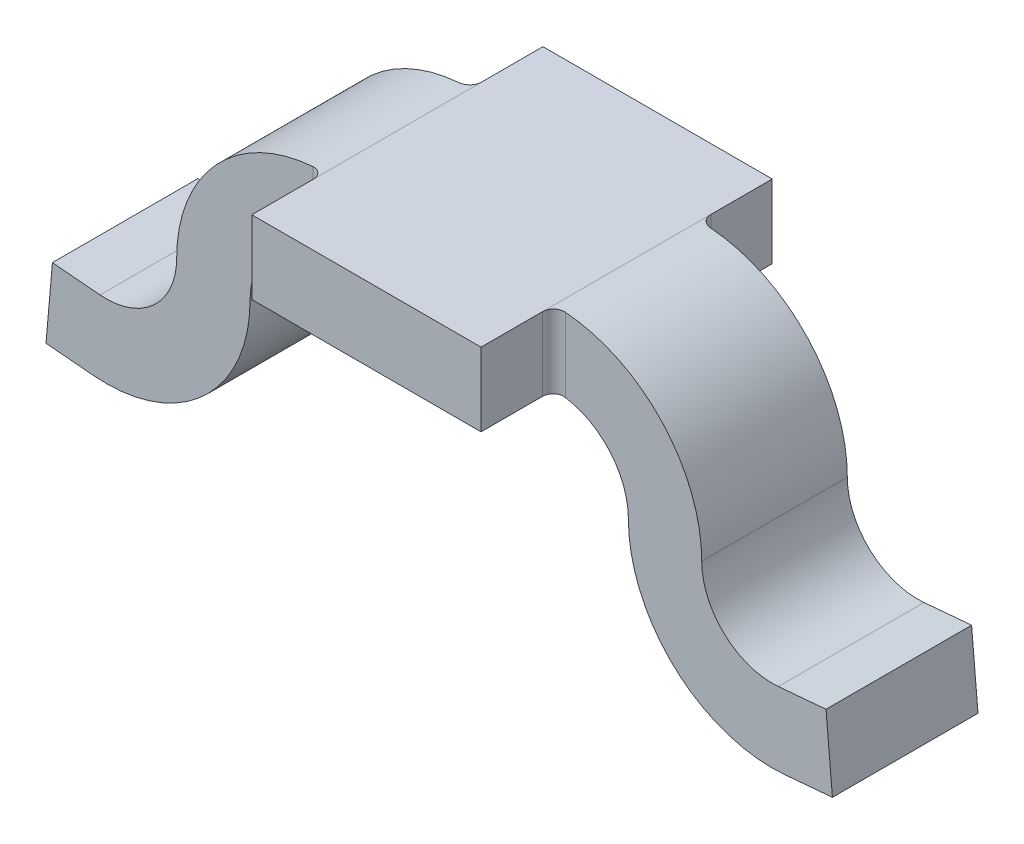
from build123d import *

# Parameters (mm, degrees)
BOSS_EXTRUDE1_DEPTH     = 1.5
CUT_EXTRUDE1_DEPTH      = 5.200365106
CUT_EXTRUDE1_DEPTH_BACK = 5.200365106
SKETCH2_OUTSIDE_W       = 10.442
SKETCH2_OUTSIDE_H       = 6.582
FILLET1_R               = 0.1


with BuildPart() as part:
    # Sketch1 → Boss-Extrude1 (new, symmetric)
    with BuildSketch(Plane.XY):
        with BuildLine():
            Line((1, 0), (-1, 0))
            ThreePointArc((-1, 0), (-1.459619408, -0.190380592), (-1.65, -0.65))
            ThreePointArc((-1.65, -0.65), (-2.057061231, -1.575117021), (-3.014135626, -1.9))
            Line((-3.014135626, -1.9), (-3.43, -1.863616582))
            Line((-3.43, -1.863616582), (-3.374220325, -1.226051975))
            Line((-3.374220325, -1.226051975), (-2.958355951, -1.262435393))
            ThreePointArc((-2.958355951, -1.262435393), (-2.489438964, -1.103259525), (-2.29, -0.65))
            ThreePointArc((-2.29, -0.65), (-1.912167748, 0.262167748), (-1, 0.64))
            Line((-1, 0.64), (1, 0.64))
            ThreePointArc((1, 0.64), (1.912167748, 0.262167748), (2.29, -0.65))
            ThreePointArc((2.29, -0.65), (2.489438964, -1.103259525), (2.958355951, -1.262435393))
            Line((2.958355951, -1.262435393), (3.374220325, -1.226051975))
            Line((3.374220325, -1.226051975), (3.43, -1.863616582))
            Line((3.43, -1.863616582), (3.014135626, -1.9))
            ThreePointArc((3.014135626, -1.9), (2.057061231, -1.575117021), (1.65, -0.65))
            ThreePointArc((1.65, -0.65), (1.459619408, -0.190380592), (1, 0))
        make_face()
    extrude(amount=BOSS_EXTRUDE1_DEPTH, both=True)

    # Sketch2 outside → Cut-Extrude1 (cut, two sides: drawn at the far end of the back side and taken through both)
    with BuildSketch(Plane(origin=(0, 0, 0), x_dir=(1, 0, 0), z_dir=(0, 1, 0)).offset(-CUT_EXTRUDE1_DEPTH_BACK)):
        Rectangle(SKETCH2_OUTSIDE_W, SKETCH2_OUTSIDE_H)
        Polygon((-1, 1.27), (1, 1.27), (1, 0.635), (3.43, 0.635), (3.43, -0.635), (1, -0.635), (1, -1.27), (-1, -1.27), (-1, -0.635), (-3.43, -0.635), (-3.43, 0.635), (-1, 0.635), align=None, mode=Mode.SUBTRACT)
    extrude(amount=CUT_EXTRUDE1_DEPTH + CUT_EXTRUDE1_DEPTH_BACK, mode=Mode.SUBTRACT)

    # Fillet1
    # the kernel refuses this fillet: 0.1 mm, written as the material it adds along each edge
    with BuildSketch(Plane(origin=(1, -0.25, 0.635), x_dir=(1, 0, 0), z_dir=(0, 1, 0))) as fillet1_piece_1_section:
        with BuildLine():
            CenterArc((FILLET1_R, -FILLET1_R), FILLET1_R, 90, 90)
            Line((0, -FILLET1_R), (0, 0))
            Line((0, 0), (FILLET1_R, 0))
        make_face()
    fillet1_piece_1 = extrude(amount=1.14, mode=Mode.PRIVATE)
    fillet1_piece_1 = fillet1_piece_1 - Plane(origin=(1, -0.65, 0.643680782), x_dir=(1, 0, 0), z_dir=(0, 0, 1)) * Cylinder(0.65, 3, mode=Mode.PRIVATE)
    fillet1_piece_1 = fillet1_piece_1 & Plane(origin=(1, -0.65, 0.643680782), x_dir=(0, 1, 0), z_dir=(0, 0, 1)) * Cylinder(1.29, 3, mode=Mode.PRIVATE)
    add(fillet1_piece_1)
    with BuildSketch(Plane(origin=(1, -0.25, -0.635), x_dir=(1, 0, 0), z_dir=(0, 1, 0))) as fillet1_piece_2_section:
        with BuildLine():
            CenterArc((FILLET1_R, FILLET1_R), FILLET1_R, 180, 90)
            Line((0, FILLET1_R), (0, 0))
            Line((0, 0), (FILLET1_R, 0))
        make_face()
    fillet1_piece_2 = extrude(amount=1.14, mode=Mode.PRIVATE)
    fillet1_piece_2 = fillet1_piece_2 - Plane(origin=(1, -0.65, -0.643680782), x_dir=(1, 0, 0), z_dir=(0, 0, 1)) * Cylinder(0.65, 3, mode=Mode.PRIVATE)
    fillet1_piece_2 = fillet1_piece_2 & Plane(origin=(1, -0.65, -0.643680782), x_dir=(0, 1, 0), z_dir=(0, 0, 1)) * Cylinder(1.29, 3, mode=Mode.PRIVATE)
    add(fillet1_piece_2)
    with BuildSketch(Plane(origin=(-1, -0.25, 0.635), x_dir=(0, 0, 1), z_dir=(0, 1, 0))) as fillet1_piece_3_section:
        with BuildLine():
            CenterArc((FILLET1_R, -FILLET1_R), FILLET1_R, 90, 90)
            Line((0, -FILLET1_R), (0, 0))
            Line((0, 0), (FILLET1_R, 0))
        make_face()
    fillet1_piece_3 = extrude(amount=1.14, mode=Mode.PRIVATE)
    fillet1_piece_3 = fillet1_piece_3 - Plane(origin=(-1, -0.65, 0.643680782), x_dir=(0, 1, 0), z_dir=(0, 0, 1)) * Cylinder(0.65, 3, mode=Mode.PRIVATE)
    fillet1_piece_3 = fillet1_piece_3 & Plane(origin=(-1, -0.65, 0.643680782), x_dir=(-1, 0, 0), z_dir=(0, 0, 1)) * Cylinder(1.29, 3, mode=Mode.PRIVATE)
    add(fillet1_piece_3)
    with BuildSketch(Plane(origin=(-1, -0.25, -0.635), x_dir=(0, 0, -1), z_dir=(0, 1, 0))) as fillet1_piece_4_section:
        with BuildLine():
            CenterArc((FILLET1_R, FILLET1_R), FILLET1_R, 180, 90)
            Line((0, FILLET1_R), (0, 0))
            Line((0, 0), (FILLET1_R, 0))
        make_face()
    fillet1_piece_4 = extrude(amount=1.14, mode=Mode.PRIVATE)
    fillet1_piece_4 = fillet1_piece_4 - Plane(origin=(-1, -0.65, -0.643680782), x_dir=(0, 1, 0), z_dir=(0, 0, 1)) * Cylinder(0.65, 3, mode=Mode.PRIVATE)
    fillet1_piece_4 = fillet1_piece_4 & Plane(origin=(-1, -0.65, -0.643680782), x_dir=(-1, 0, 0), z_dir=(0, 0, 1)) * Cylinder(1.29, 3, mode=Mode.PRIVATE)
    add(fillet1_piece_4)


solid = part.part
